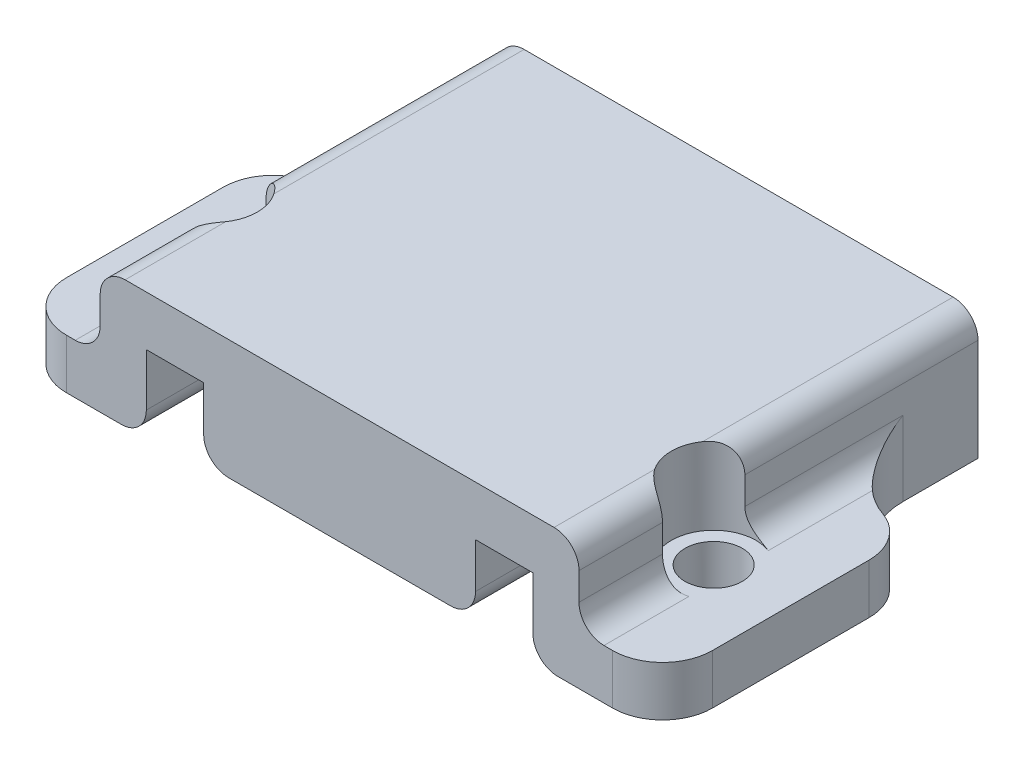
from build123d import *

# Parameters (mm, degrees)
BOSS_EXTRUDE1_DEPTH = 2
SKETCH3_W           = 1.85
SKETCH3_H           = 16
BOSS_EXTRUDE2_DEPTH = 3.1
SKETCH4_W           = 3.35
SKETCH4_H           = 10
BOSS_EXTRUDE3_DEPTH = 2
SKETCH5_W           = 10.9
SKETCH5_H           = 3
BOSS_EXTRUDE4_DEPTH = 2.8
FILLET2_R           = 1
SKETCH7_R           = 1.15
CUT_EXTRUDE2_DEPTH  = 18.740138105
CUT_EXTRUDE3_REACH  = 19.74
SKETCH8_R           = 1.7
FILLET3_START       = -6.300522805
FILLET3_DEPTH       = 1.300522805
FILLET3_START_2     = -8.0000001
FILLET3_2_DEPTH     = 1.699477295
FILLET3_3_DEPTH     = 1.300522805
FILLET3_START_3     = -1.1
FILLET3_4_DEPTH     = 2.1
FILLET3_START_4     = -3.1
FILLET3_5_DEPTH     = 2
FILLET4_R           = 2


with BuildPart() as part:
    # Sketch2 → Boss-Extrude1 (new body)
    with BuildSketch(Plane(origin=(0, 0, 0), x_dir=(1, 0, 0), z_dir=(0, 1, 0))):
        Polygon((9.6, -5), (-9.6, -5), (-9.6, 5), (-9.6, 11), (9.6, 11), (9.6, 5), align=None)
    extrude(amount=BOSS_EXTRUDE1_DEPTH)

    # Sketch3 → Boss-Extrude2 (add)
    with BuildSketch(Plane(origin=(0, 0, 0), x_dir=(1, 0, 0), z_dir=(0, 1, 0))):
        with Locations((-8.675, 3)):
            Rectangle(SKETCH3_W, SKETCH3_H)
        with Locations((8.675, 3)):
            Rectangle(SKETCH3_W, SKETCH3_H)
    extrude(amount=-BOSS_EXTRUDE2_DEPTH)

    # Sketch4 → Boss-Extrude3 (add)
    with BuildSketch(Plane(origin=(0, -3.1, 0), x_dir=(1, 0, 0), z_dir=(0, 1, 0))):
        with Locations((-11.275, 0)):
            Rectangle(SKETCH4_W, SKETCH4_H)
        with Locations((11.275, 0)):
            Rectangle(SKETCH4_W, SKETCH4_H)
    extrude(amount=BOSS_EXTRUDE3_DEPTH)

    # Sketch5 → Boss-Extrude4 (add)
    with BuildSketch(Plane.XZ):
        with Locations((0, 3.5)):
            Rectangle(SKETCH5_W, SKETCH5_H)
    extrude(amount=BOSS_EXTRUDE4_DEPTH)

    # Fillet2
    fillet2_edges = [part.edges().sort_by_distance(p)[0] for p in [
        (-9.6, 2, -3),
        (-7.75, -3.1, -3),
        (7.75, -3.1, -3),
        (9.6, 2, -3),
        (-9.6, -1.1, 0),
        (9.6, -1.1, 0),
        (-5.45, -2.8, 3.5),
        (5.45, -2.8, 3.5),
    ]]
    fillet(fillet2_edges, radius=FILLET2_R)

    # Sketch7 → Cut-Extrude2 (cut, through all)
    with BuildSketch(Plane(origin=(0, 2, 0), x_dir=(1, 0, 0), z_dir=(0, 1, 0))):
        with Locations(Location((-10, 0, 0), (0, 0, 270))):
            Circle(SKETCH7_R)
        with Locations(Location((10, 0, 0), (0, 0, 270))):
            Circle(SKETCH7_R)
    extrude(amount=-CUT_EXTRUDE2_DEPTH, mode=Mode.SUBTRACT)

    # Cut-Extrude3: up to this face of the body (flat: up to its plane)
    cut_extrude3_end = Plane(part.part.faces().sort_by_distance((11.806864318, -1.1, 0))[0])
    # Sketch8 → Cut-Extrude3 (cut, up to the picked face)
    with BuildSketch(Plane(origin=(0, 2, 0), x_dir=(1, 0, 0), z_dir=(0, 1, 0)), mode=Mode.PRIVATE) as cut_extrude3_sk1:
        with Locations((-10, 0)):
            Circle(SKETCH8_R)
    cut_extrude3_tool1 = split(extrude(cut_extrude3_sk1.sketch, amount=-CUT_EXTRUDE3_REACH, mode=Mode.PRIVATE), bisect_by=cut_extrude3_end, keep=Keep.BOTH, mode=Mode.PRIVATE)
    # Sketch8 → Cut-Extrude3 (cut, up to the picked face)
    with BuildSketch(Plane(origin=(0, 2, 0), x_dir=(1, 0, 0), z_dir=(0, 1, 0)), mode=Mode.PRIVATE) as cut_extrude3_sk2:
        with Locations((10, 0)):
            Circle(SKETCH8_R)
    cut_extrude3_tool2 = split(extrude(cut_extrude3_sk2.sketch, amount=-CUT_EXTRUDE3_REACH, mode=Mode.PRIVATE), bisect_by=cut_extrude3_end, keep=Keep.BOTH, mode=Mode.PRIVATE)
    add(cut_extrude3_tool1.solids().sort_by(Axis((-10, 2, 0), (0, -1, 0)))[0], mode=Mode.SUBTRACT)
    add(cut_extrude3_tool2.solids().sort_by(Axis((10, 2, 0), (0, -1, 0)))[0], mode=Mode.SUBTRACT)

    # Fillet3: read off the stored shape, not the designer's step
    # Fillet3 outline → Fillet3 (add)
    with BuildSketch(Plane.XY.offset(FILLET3_START)):
        with BuildLine():
            Line((9.6, -1.1), (10.6, -1.1))
            ThreePointArc((10.6, -1.1), (9.892893219, -0.807106781), (9.6, -0.1))
            Line((9.6, -0.1), (9.6, -1.1))
        make_face()
    extrude(amount=FILLET3_DEPTH)

    # Fillet3 2 outline → Fillet3 2 (add)
    with BuildSketch(Plane.XY.offset(FILLET3_START_2)):
        with BuildLine():
            Line((-9.6, -1.1), (-9.6, -0.1))
            ThreePointArc((-9.6, -0.1), (-9.892893219, -0.807106781), (-10.6, -1.1))
            Line((-10.6, -1.1), (-9.6, -1.1))
        make_face()
        with BuildLine():
            Line((9.6, -1.1), (10.6, -1.1))
            ThreePointArc((10.6, -1.1), (9.892893219, -0.807106781), (9.6, -0.1))
            Line((9.6, -0.1), (9.6, -1.1))
        make_face()
    extrude(amount=FILLET3_2_DEPTH)

    # Fillet3 3 outline → Fillet3 3 (add)
    with BuildSketch(Plane.XY.offset(FILLET3_START)):
        with BuildLine():
            Line((-9.6, -1.1), (-9.6, -0.1))
            ThreePointArc((-9.6, -0.1), (-9.892893219, -0.807106781), (-10.6, -1.1))
            Line((-10.6, -1.1), (-9.6, -1.1))
        make_face()
    extrude(amount=FILLET3_3_DEPTH)

    # Fillet3 4 outline → Fillet3 4 (cut)
    with BuildSketch(Plane(origin=(0, 0, 0), x_dir=(1, 0, 0), z_dir=(0, 1, 0)).offset(FILLET3_START_3)):
        with BuildLine():
            Line((14, 8.0000001), (9.6, 8))
            ThreePointArc((9.6, 8), (10.478679656, 5.878679656), (12.6, 5))
            Line((12.6, 5), (12.95, 5))
            Line((12.95, 5), (14, 5.000000001))
            Line((14, 5.000000001), (14, 8.0000001))
        make_face()
        with BuildLine():
            Line((-12.95, 5), (-12.6, 5))
            ThreePointArc((-12.6, 5), (-10.478679656, 5.878679656), (-9.6, 8))
            Line((-9.6, 8), (-14, 8.0000001))
            Line((-14, 8.0000001), (-14, 5))
            Line((-14, 5), (-12.95, 5))
        make_face()
    extrude(amount=FILLET3_4_DEPTH, mode=Mode.SUBTRACT)

    # Fillet3 5 outline → Fillet3 5 (add)
    with BuildSketch(Plane(origin=(0, 0, 0), x_dir=(1, 0, 0), z_dir=(0, 1, 0)).offset(FILLET3_START_4)):
        with BuildLine():
            ThreePointArc((12.6, 5), (10.478679656, 5.878679656), (9.6, 8))
            Line((9.6, 8), (9.6, 5))
            Line((9.6, 5), (12.6, 5))
        make_face()
        with BuildLine():
            Line((-12.6, 5), (-9.6, 5))
            Line((-9.6, 5), (-9.6, 8))
            ThreePointArc((-9.6, 8), (-10.478679656, 5.878679656), (-12.6, 5))
        make_face()
    extrude(amount=FILLET3_5_DEPTH)

    # Fillet4
    fillet4_edges = [part.edges().sort_by_distance(p)[0] for p in [
        (12.95, -2.1, -5),
        (12.95, -2.1, 5),
        (-12.95, -2.1, -5),
        (-12.95, -2.1, 5),
    ]]
    fillet(fillet4_edges, radius=FILLET4_R)


solid = part.part
